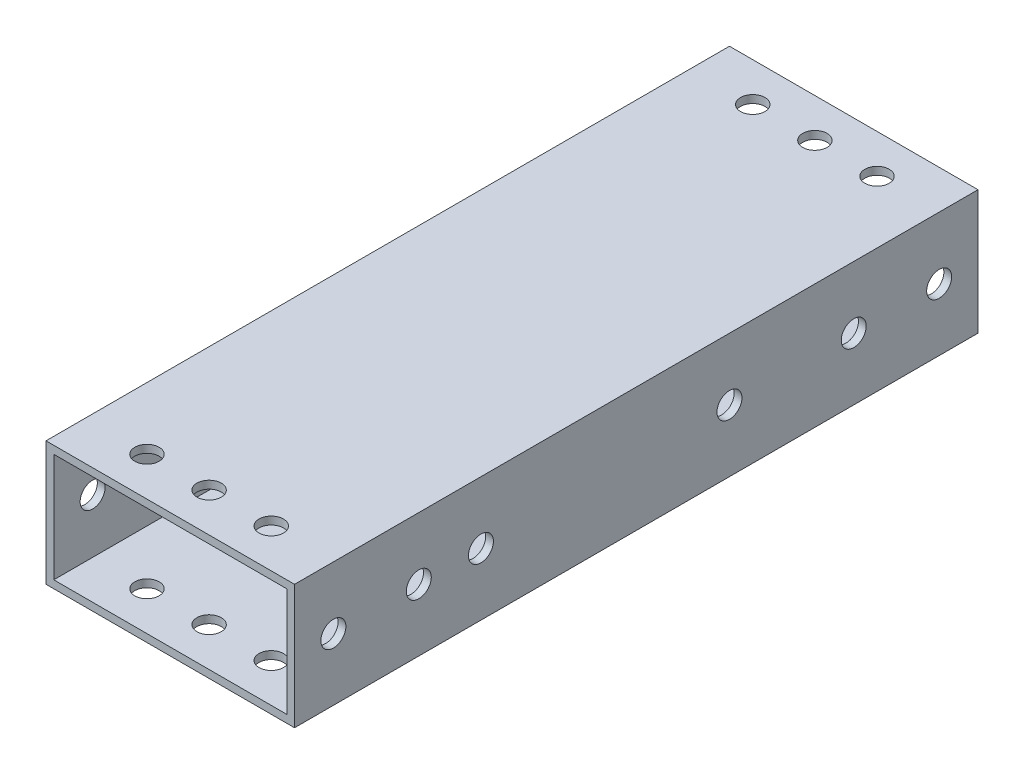
from build123d import *

# Parameters (mm, degrees)
SKETCH1_W           = 50.8
SKETCH1_H           = 25.4
SKETCH1_W_2         = 47.625
SKETCH1_H_2         = 22.225
BOSS_EXTRUDE1_DEPTH = 69.85
SKETCH2_R           = 2.4892
CUT_EXTRUDE1_DEPTH  = 79.545162168
SKETCH3_R           = 2.5527
CUT_EXTRUDE2_DEPTH  = 88.298066989
SKETCH5_R           = 2.5527
CUT_EXTRUDE3_DEPTH  = 88.298066989


with BuildPart() as part:
    # Sketch1 → Boss-Extrude1 (new, symmetric)
    with BuildSketch(Plane.XY):
        Rectangle(SKETCH1_W, SKETCH1_H)
        Rectangle(SKETCH1_W_2, SKETCH1_H_2, mode=Mode.SUBTRACT)
    extrude(amount=BOSS_EXTRUDE1_DEPTH, both=True)

    # Sketch2 → Cut-Extrude1 (cut, through all)
    with BuildSketch(Plane(origin=(0, 12.7, 0), x_dir=(1, 0, 0), z_dir=(0, 1, 0))):
        with Locations((-12.7, 61.9125)):
            Circle(SKETCH2_R)
        with Locations((0, 61.9125)):
            Circle(SKETCH2_R)
        with Locations((12.7, 61.9125)):
            Circle(SKETCH2_R)
        with Locations((12.7, -61.9125)):
            Circle(SKETCH2_R)
        with Locations((0, -61.9125)):
            Circle(SKETCH2_R)
        with Locations((-12.7, -61.9125)):
            Circle(SKETCH2_R)
    extrude(amount=-CUT_EXTRUDE1_DEPTH, mode=Mode.SUBTRACT)

    # Sketch3 → Cut-Extrude2 (cut, through all)
    with BuildSketch(Plane.ZY.offset(25.4)):
        with Locations((-61.9125, 0)):
            Circle(SKETCH3_R)
        with Locations((61.9125, 0)):
            Circle(SKETCH3_R)
        with Locations((31.75, 0)):
            Circle(SKETCH3_R)
        with Locations((44.45, 0)):
            Circle(SKETCH3_R)
    extrude(amount=-CUT_EXTRUDE2_DEPTH, mode=Mode.SUBTRACT)

    # Sketch5 → Cut-Extrude3 (cut, through all)
    with BuildSketch(Plane(origin=(25.4, 0, 0), x_dir=(0, 0, -1), z_dir=(1, 0, 0))):
        with Locations((44.45, 0)):
            Circle(SKETCH5_R)
        with Locations((19.05, 0)):
            Circle(SKETCH5_R)
    extrude(amount=-CUT_EXTRUDE3_DEPTH, mode=Mode.SUBTRACT)


solid = part.part
